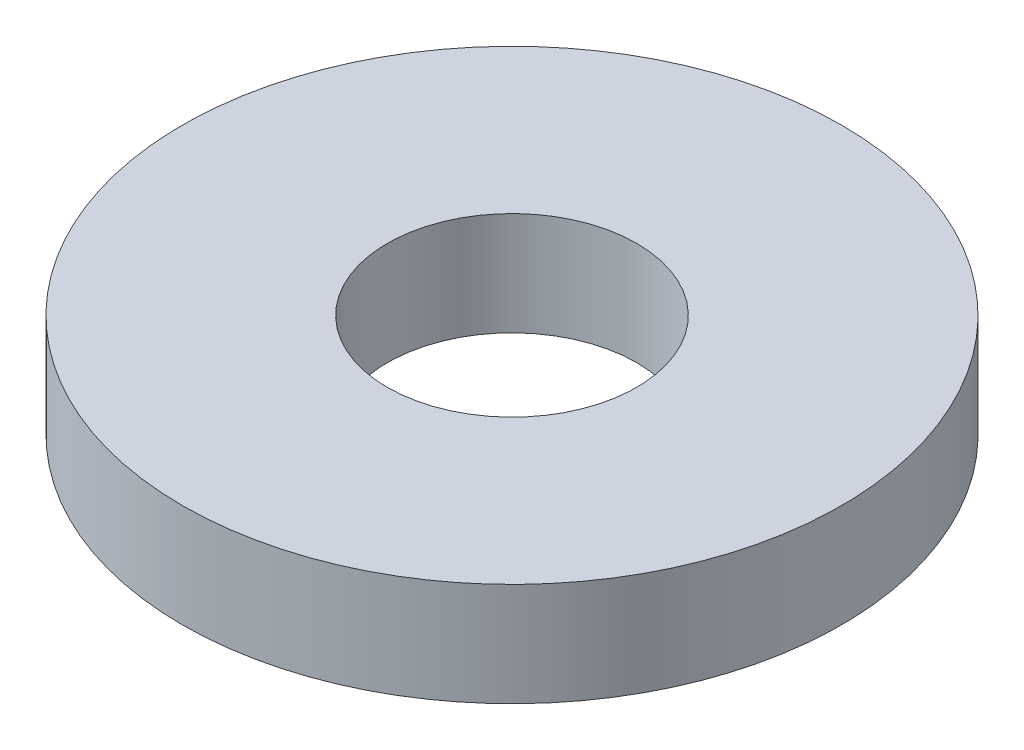
from build123d import *

# Parameters (mm, degrees)
SKETCH1_R           = 92.5
BOSS_EXTRUDE1_DEPTH = 29
SKETCH2_R           = 35
CUT_EXTRUDE1_DEPTH  = 134.990671317


with BuildPart() as part:
    # Sketch1 → Boss-Extrude1 (new body)
    with BuildSketch(Plane(origin=(0, 0, 0), x_dir=(1, 0, 0), z_dir=(0, 1, 0))):
        Circle(SKETCH1_R)
    extrude(amount=BOSS_EXTRUDE1_DEPTH)

    # Sketch2 → Cut-Extrude1 (cut, through all)
    with BuildSketch(Plane(origin=(0, 0, 0), x_dir=(1, 0, 0), z_dir=(0, 1, 0))):
        Circle(SKETCH2_R)
    extrude(amount=CUT_EXTRUDE1_DEPTH, mode=Mode.SUBTRACT)


solid = part.part
